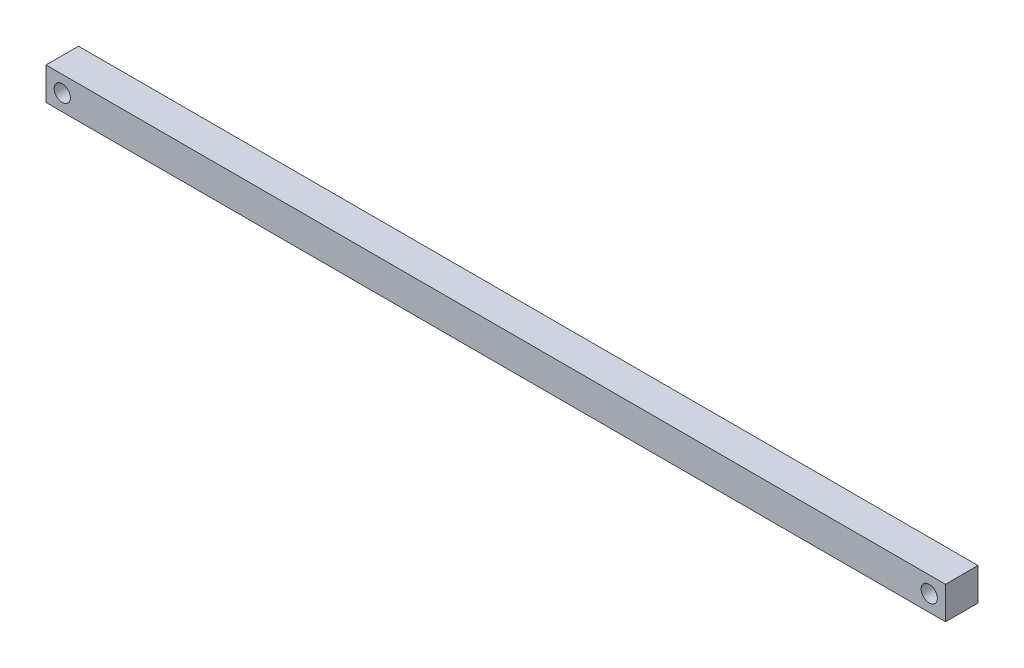
from build123d import *

# Parameters (mm, degrees)
SKETCH1_W           = 830
SKETCH1_H           = 30
SKETCH1_R           = 7.5
BOSS_EXTRUDE1_DEPTH = 15


with BuildPart() as part:
    # Sketch1 → Boss-Extrude1 (new, symmetric)
    with BuildSketch(Plane.XY):
        Rectangle(SKETCH1_W, SKETCH1_H)
        with Locations((-400, 0)):
            Circle(SKETCH1_R, mode=Mode.SUBTRACT)
        with Locations((400, 0)):
            Circle(SKETCH1_R, mode=Mode.SUBTRACT)
    extrude(amount=BOSS_EXTRUDE1_DEPTH, both=True)


solid = part.part
